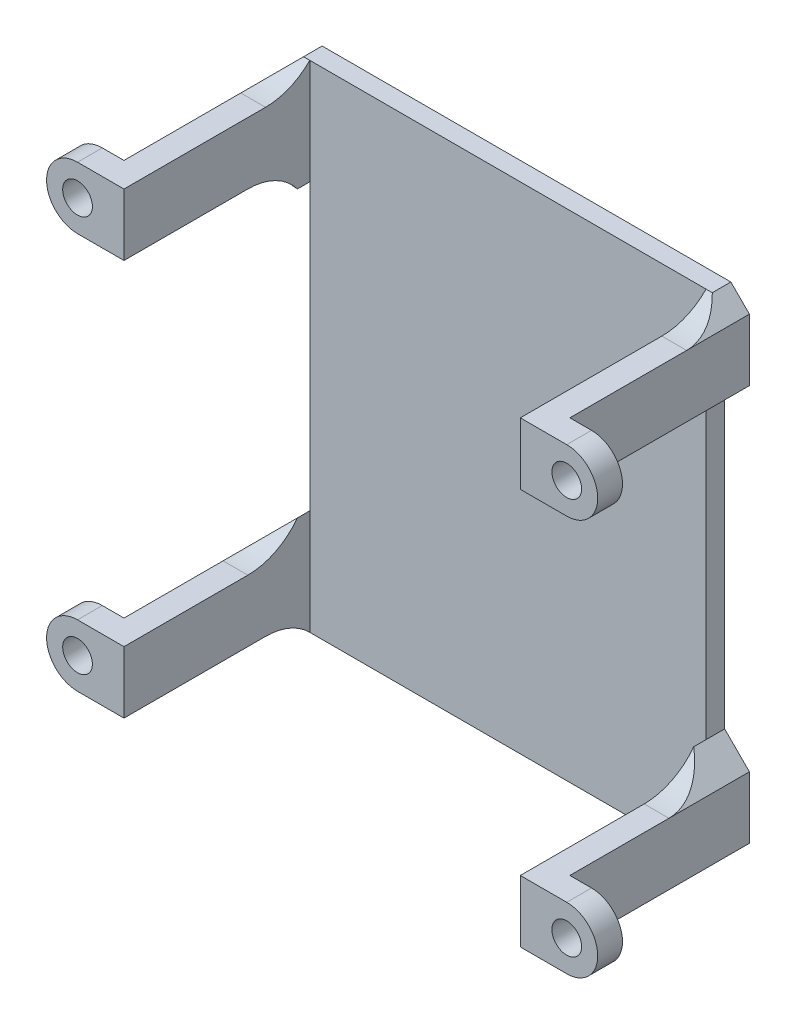
from build123d import *

# Parameters (mm, degrees)
SKETCH1_W               = 32
SKETCH1_H               = 40
BOSS_EXTRUDE1_DEPTH     = 1.5
SKETCH2_R               = 1.2
BOSS_EXTRUDE2_DEPTH     = 16.5
CUT_EXTRUDE1_DEPTH      = 35.165955277
CUT_EXTRUDE1_DEPTH_BACK = 35.165955277
SKETCH4_W               = 10
SKETCH4_H               = 14.5
CHAMFER1_SIZE           = 2
FILLET1_R               = 5


with BuildPart() as part:
    # Sketch1 → Boss-Extrude1 (new body)
    with BuildSketch(Plane.XY):
        Rectangle(SKETCH1_W, SKETCH1_H)
    extrude(amount=BOSS_EXTRUDE1_DEPTH)

    # Sketch2 → Boss-Extrude2 (add)
    # profile 1 of 4: a face of its own
    with BuildSketch(Plane.XY):
        with BuildLine():
            Line((-16, 18.5), (-19.75, 18.5))
            ThreePointArc((-19.75, 18.5), (-22.25, 16), (-19.75, 13.5))
            Line((-19.75, 13.5), (-16, 13.5))
            Line((-16, 13.5), (-16, 18.5))
        make_face()
        with Locations((-19.75, 16)):
            Circle(SKETCH2_R, mode=Mode.SUBTRACT)
    # profile 2 of 4: a face of its own
    with BuildSketch(Plane.XY):
        with BuildLine():
            Line((16, 18.5), (16, 13.5))
            Line((16, 13.5), (19.75, 13.5))
            ThreePointArc((19.75, 13.5), (22.25, 16), (19.75, 18.5))
            Line((19.75, 18.5), (16, 18.5))
        make_face()
        with Locations(Location((19.75, 16, 0), (0, 0, 180))):
            Circle(SKETCH2_R, mode=Mode.SUBTRACT)
    # profile 3 of 4: a face of its own
    with BuildSketch(Plane.XY):
        with BuildLine():
            Line((16, -18.5), (19.75, -18.5))
            ThreePointArc((19.75, -18.5), (22.25, -16), (19.75, -13.5))
            Line((19.75, -13.5), (16, -13.5))
            Line((16, -13.5), (16, -18.5))
        make_face()
        with Locations((19.75, -16)):
            Circle(SKETCH2_R, mode=Mode.SUBTRACT)
    # profile 4 of 4: a face of its own
    with BuildSketch(Plane.XY):
        with BuildLine():
            Line((-16, -18.5), (-16, -13.5))
            Line((-16, -13.5), (-19.75, -13.5))
            ThreePointArc((-19.75, -13.5), (-22.25, -16), (-19.75, -18.5))
            Line((-19.75, -18.5), (-16, -18.5))
        make_face()
        with Locations(Location((-19.75, -16, 0), (0, 0, 180))):
            Circle(SKETCH2_R, mode=Mode.SUBTRACT)
    extrude(amount=BOSS_EXTRUDE2_DEPTH)

    # Sketch4 → Cut-Extrude1 (cut, two sides: drawn at the far end of the back side and taken through both)
    with BuildSketch(Plane(origin=(0, 0, 0), x_dir=(1, 0, 0), z_dir=(0, 1, 0)).offset(-CUT_EXTRUDE1_DEPTH_BACK)):
        with Locations((-23, -7.25)):
            Rectangle(SKETCH4_W, SKETCH4_H)
        with Locations((23, -7.25)):
            Rectangle(SKETCH4_W, SKETCH4_H)
    extrude(amount=CUT_EXTRUDE1_DEPTH + CUT_EXTRUDE1_DEPTH_BACK, mode=Mode.SUBTRACT)

    # Chamfer1
    # the kernel refuses this chamfer: 2 mm, written as the material it adds along each edge
    with BuildSketch(Plane(origin=(-16, -13.5, 0), x_dir=(-1, 0, 0), z_dir=(0, 0, 1)), Plane(origin=(-16, 13.5, 0), x_dir=(0, -1, 0), z_dir=(0, 0, 1)), Plane(origin=(16, -13.5, 0), x_dir=(0, 1, 0), z_dir=(0, 0, 1)), Plane(origin=(16, 13.5, 0), x_dir=(1, 0, 0), z_dir=(0, 0, 1))) as chamfer1_piece_1:
        Polygon((CHAMFER1_SIZE, 0), (0, -CHAMFER1_SIZE), (0, 0), align=None)
    extrude(amount=1.5)
    with BuildSketch(Plane(origin=(-16, -18.5, 0), x_dir=(0, -1, 0), z_dir=(0, 0, 1))) as chamfer1_piece_2_section:
        Polygon((CHAMFER1_SIZE, 0), (0, -CHAMFER1_SIZE), (0, 0), align=None)
    chamfer1_piece_2 = extrude(amount=1.5, mode=Mode.PRIVATE)
    chamfer1_piece_2 = split(chamfer1_piece_2, bisect_by=Plane(origin=(-16, -20, 0), z_dir=(0, 1, 0)), keep=Keep.TOP, mode=Mode.PRIVATE)
    add(chamfer1_piece_2)
    with BuildSketch(Plane(origin=(-16, 18.5, 0), x_dir=(0, 1, 0), z_dir=(0, 0, 1))) as chamfer1_piece_3_section:
        Polygon((CHAMFER1_SIZE, 0), (0, CHAMFER1_SIZE), (0, 0), align=None)
    chamfer1_piece_3 = extrude(amount=1.5, mode=Mode.PRIVATE)
    chamfer1_piece_3 = split(chamfer1_piece_3, bisect_by=Plane(origin=(-16, 20, 0), z_dir=(0, -1, 0)), keep=Keep.TOP, mode=Mode.PRIVATE)
    add(chamfer1_piece_3)
    with BuildSketch(Plane(origin=(16, -18.5, 0), x_dir=(1, 0, 0), z_dir=(0, 0, 1))) as chamfer1_piece_4_section:
        Polygon((CHAMFER1_SIZE, 0), (0, -CHAMFER1_SIZE), (0, 0), align=None)
    chamfer1_piece_4 = extrude(amount=1.5, mode=Mode.PRIVATE)
    chamfer1_piece_4 = split(chamfer1_piece_4, bisect_by=Plane(origin=(16, -20, 0), z_dir=(0, 1, 0)), keep=Keep.TOP, mode=Mode.PRIVATE)
    add(chamfer1_piece_4)
    with BuildSketch(Plane(origin=(16, 18.5, 0), x_dir=(0, 1, 0), z_dir=(0, 0, 1))) as chamfer1_piece_5_section:
        Polygon((CHAMFER1_SIZE, 0), (0, -CHAMFER1_SIZE), (0, 0), align=None)
    chamfer1_piece_5 = extrude(amount=1.5, mode=Mode.PRIVATE)
    chamfer1_piece_5 = split(chamfer1_piece_5, bisect_by=Plane(origin=(16, 20, 0), z_dir=(0, -1, 0)), keep=Keep.TOP, mode=Mode.PRIVATE)
    add(chamfer1_piece_5)

    # Fillet1
    # the kernel refuses this fillet: 5 mm, written as the material it adds along each edge
    with BuildSketch(Plane(origin=(-16, -13.5, 1.5), x_dir=(0, 0, 1), z_dir=(-1, 0, 0))) as fillet1_piece_1_section:
        with BuildLine():
            CenterArc((FILLET1_R, FILLET1_R), FILLET1_R, 180, 90)
            Line((0, FILLET1_R), (0, 0))
            Line((0, 0), (FILLET1_R, 0))
        make_face()
    fillet1_piece_1 = extrude(amount=14.5, mode=Mode.PRIVATE)
    fillet1_piece_1 = split(fillet1_piece_1, bisect_by=Plane(origin=(-17, -12.5, 1.5), z_dir=(0.7071067811865476, -0.7071067811865476, 0)), keep=Keep.TOP, mode=Mode.PRIVATE)
    add(fillet1_piece_1)
    with BuildSketch(Plane(origin=(-26.926785536, -18.5, 1.5), x_dir=(0, 0, 1), z_dir=(1, 0, 0))) as fillet1_piece_2_section:
        with BuildLine():
            CenterArc((3.570714214, 5), FILLET1_R, 224.427004001, 45.572995999)
            Line((0, 1.5), (0, 0))
            Line((0, 0), (3.570714214, 0))
        make_face()
    fillet1_piece_2 = extrude(amount=10.926785536, mode=Mode.PRIVATE)
    fillet1_piece_2 = split(fillet1_piece_2, bisect_by=Plane(origin=(-22.463392768, -14.036607232, 1.5), z_dir=(0.7071067811865476, 0.7071067811865476, 0)), keep=Keep.TOP, mode=Mode.PRIVATE)
    add(fillet1_piece_2)
    with BuildSketch(Plane(origin=(-30.5, 13.5, 1.5), x_dir=(0, 0, 1), z_dir=(1, 0, 0))) as fillet1_piece_3_section:
        with BuildLine():
            CenterArc((FILLET1_R, FILLET1_R), FILLET1_R, 180, 90)
            Line((0, FILLET1_R), (0, 0))
            Line((0, 0), (FILLET1_R, 0))
        make_face()
    fillet1_piece_3 = extrude(amount=14.5, mode=Mode.PRIVATE)
    fillet1_piece_3 = split(fillet1_piece_3, bisect_by=Plane(origin=(-24.25, 19.75, 1.5), z_dir=(0.7071067811865476, 0.7071067811865476, 0)), keep=Keep.TOP, mode=Mode.PRIVATE)
    add(fillet1_piece_3)
    with BuildSketch(Plane(origin=(-26.926785536, 18.5, 1.5), x_dir=(0, 0, 1), z_dir=(1, 0, 0))) as fillet1_piece_4_section:
        with BuildLine():
            CenterArc((3.570714214, -5), FILLET1_R, 90, 45.572995999)
            Line((0, -1.5), (0, 0))
            Line((0, 0), (3.570714214, 0))
        make_face()
    fillet1_piece_4 = extrude(amount=10.926785536, mode=Mode.PRIVATE)
    fillet1_piece_4 = split(fillet1_piece_4, bisect_by=Plane(origin=(-22.463392768, 14.036607232, 1.5), z_dir=(0.7071067811865476, -0.7071067811865476, 0)), keep=Keep.TOP, mode=Mode.PRIVATE)
    add(fillet1_piece_4)
    with BuildSketch(Plane(origin=(16, -18.5, 1.5), x_dir=(0, 0, 1), z_dir=(1, 0, 0))) as fillet1_piece_5_section:
        with BuildLine():
            CenterArc((3.570714214, 5), FILLET1_R, 224.427004001, 45.572995999)
            Line((0, 1.5), (0, 0))
            Line((0, 0), (3.570714214, 0))
        make_face()
    fillet1_piece_5 = extrude(amount=10.926785536, mode=Mode.PRIVATE)
    fillet1_piece_5 = split(fillet1_piece_5, bisect_by=Plane(origin=(17, -19.5, 1.5), z_dir=(-0.7071067811865476, 0.7071067811865476, 0)), keep=Keep.TOP, mode=Mode.PRIVATE)
    add(fillet1_piece_5)
    with BuildSketch(Plane(origin=(30.5, -13.5, 1.5), x_dir=(0, 0, 1), z_dir=(-1, 0, 0))) as fillet1_piece_6_section:
        with BuildLine():
            CenterArc((FILLET1_R, FILLET1_R), FILLET1_R, 180, 90)
            Line((0, FILLET1_R), (0, 0))
            Line((0, 0), (FILLET1_R, 0))
        make_face()
    fillet1_piece_6 = extrude(amount=14.5, mode=Mode.PRIVATE)
    fillet1_piece_6 = split(fillet1_piece_6, bisect_by=Plane(origin=(24.25, -19.75, 1.5), z_dir=(-0.7071067811865476, -0.7071067811865476, 0)), keep=Keep.TOP, mode=Mode.PRIVATE)
    add(fillet1_piece_6)
    with BuildSketch(Plane(origin=(16, 13.5, 1.5), x_dir=(0, -1, 0), z_dir=(1, 0, 0))) as fillet1_piece_7_section:
        with BuildLine():
            CenterArc((FILLET1_R, -FILLET1_R), FILLET1_R, 90, 90)
            Line((0, -FILLET1_R), (0, 0))
            Line((0, 0), (FILLET1_R, 0))
        make_face()
    fillet1_piece_7 = extrude(amount=14.5, mode=Mode.PRIVATE)
    fillet1_piece_7 = split(fillet1_piece_7, bisect_by=Plane(origin=(17, 12.5, 1.5), z_dir=(-0.7071067811865476, 0.7071067811865476, 0)), keep=Keep.TOP, mode=Mode.PRIVATE)
    add(fillet1_piece_7)
    with BuildSketch(Plane(origin=(26.926785536, 18.5, 1.5), x_dir=(0, 1, 0), z_dir=(-1, 0, 0))) as fillet1_piece_8_section:
        with BuildLine():
            CenterArc((5, -3.570714214), FILLET1_R, 134.427004001, 45.572995999)
            Line((0, -3.570714214), (0, 0))
            Line((0, 0), (1.5, 0))
        make_face()
    fillet1_piece_8 = extrude(amount=10.926785536, mode=Mode.PRIVATE)
    fillet1_piece_8 = split(fillet1_piece_8, bisect_by=Plane(origin=(22.463392768, 14.036607232, 1.5), z_dir=(-0.7071067811865476, -0.7071067811865476, 0)), keep=Keep.TOP, mode=Mode.PRIVATE)
    add(fillet1_piece_8)


solid = part.part
